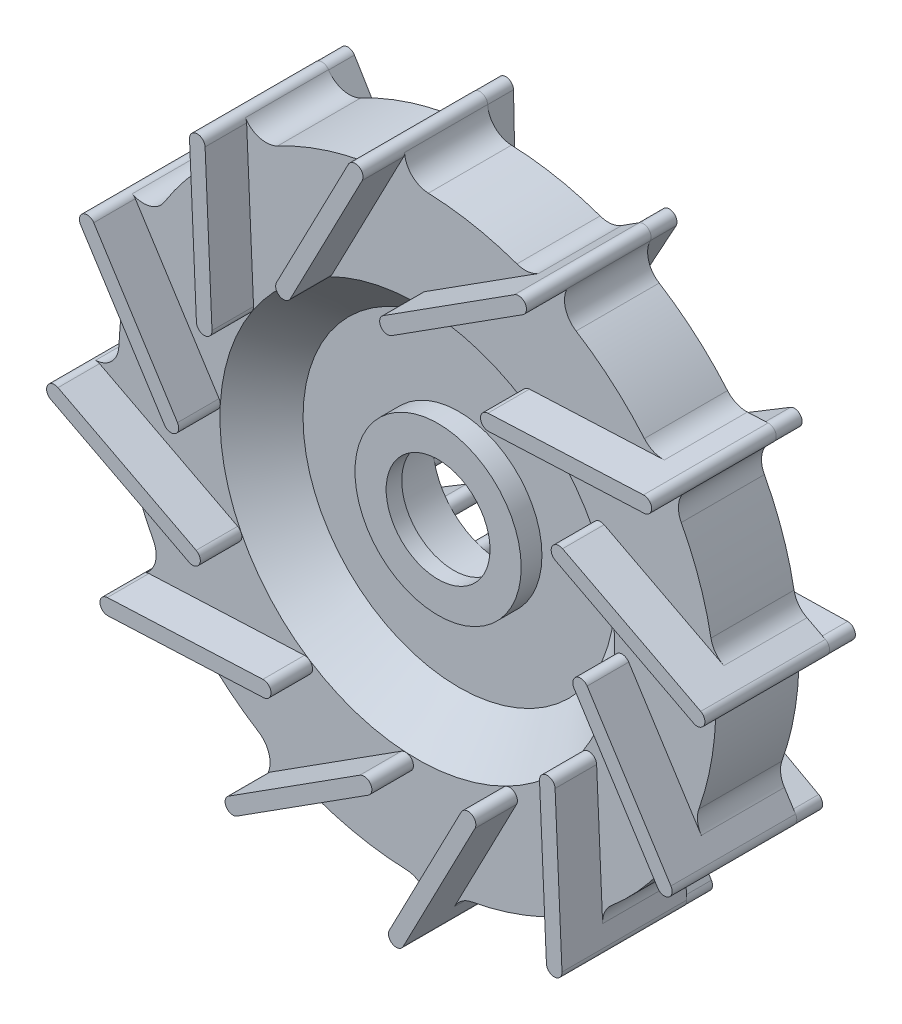
from build123d import *

# Parameters (mm, degrees)
SKETCH2_R                = 57.5
CUT_EXTRUDE1_DEPTH       = 8
SKETCH2_5_R              = 63.5
SKETCH2_5_R_2            = 57.5
CUT_EXTRUDE2_DEPTH       = 93.954289842
BOSS_EXTRUDE1_REACH      = 86.785
BOSS_EXTRUDE3_START      = -24
BOSS_EXTRUDE3_DEPTH      = 5
FILLET1_R                = 4.7625
CIRPATTERN1_COUNT        = 12
FILLET1_OF_CIRPATTERN1_R = 4.7625


with BuildPart() as part:
    # Sketch1 → Revolve1 (revolve)
    with BuildSketch(Plane.YZ, mode=Mode.PRIVATE) as revolve1_sk:
        Polygon((13, -24), (13, -15), (10, -15), (10, -12), (16, -12), (16, -16), (30, -16), (38, -8), (38, 0), (63.5, 0), (63.5, -24), align=None)
    revolve(revolve1_sk.sketch.rotate(Axis((0, 0, 0), (0, 0, -1)), 90), axis=Axis((0, 0, 0), (0, 0, -1)))

    # Sketch2 → Cut-Extrude1 (cut)
    with BuildSketch(Plane.XY):
        Circle(SKETCH2_R)
    extrude(amount=-CUT_EXTRUDE1_DEPTH, mode=Mode.SUBTRACT)

    # Sketch2<5> → Cut-Extrude2 (cut, through all)
    with BuildSketch(Plane.XY):
        Circle(SKETCH2_5_R)
        Circle(SKETCH2_5_R_2, mode=Mode.SUBTRACT)
    extrude(amount=-CUT_EXTRUDE2_DEPTH, mode=Mode.SUBTRACT)

    # Boss-Extrude1: up to this face of the body (flat: up to its plane)
    boss_extrude1_end = Plane(part.part.faces().sort_by_distance((-55.873654403, 0, -24))[0])
    # Sketch2<6> → Boss-Extrude1 (add, up to the picked face)
    with BuildSketch(Plane.XY, mode=Mode.PRIVATE) as boss_extrude1_sk1:
        with BuildLine():
            Line((26.708362532, 56.824389951), (1.442963276, 40.7003167))
            ThreePointArc((1.442963276, 40.7003167), (0.985471346, 38.628915934), (3.056872112, 38.171424003))
            Line((3.056872112, 38.171424003), (28.322271367, 54.295497255))
            ThreePointArc((28.322271367, 54.295497255), (28.779763298, 56.366898021), (26.708362532, 56.824389951))
        make_face()
    boss_extrude1_tool1 = split(extrude(boss_extrude1_sk1.sketch, amount=-BOSS_EXTRUDE1_REACH, mode=Mode.PRIVATE), bisect_by=boss_extrude1_end, keep=Keep.BOTH, mode=Mode.PRIVATE)
    boss_extrude1 = boss_extrude1_tool1.solids().sort_by(Axis((14.882617, 47.497907, 0), (0, 0, -1)))[0]
    add(boss_extrude1)

    # Sketch2<9> → Boss-Extrude3 (add)
    with BuildSketch(Plane.XY.offset(BOSS_EXTRUDE3_START)):
        with BuildLine():
            Line((24.646780442, 51.949843251), (23.4144745, 51.163400454))
            Line((23.4144745, 51.163400454), (14.5758672, 35.093362554))
            ThreePointArc((14.5758672, 35.093362554), (15.929849573, 34.499853515), (17.259721819, 33.854128297))
            Line((17.259721819, 33.854128297), (26.660264341, 50.945856606))
            ThreePointArc((26.660264341, 50.945856606), (25.658433475, 51.457699051), (24.646780442, 51.949843251))
        make_face()
        with BuildLine():
            Line((26.223407223, 56.270500903), (24.010455029, 52.246990816))
            ThreePointArc((24.010455029, 52.246990816), (24.329071398, 52.099388527), (24.646780442, 51.949843251))
            Line((24.646780442, 51.949843251), (28.322271367, 54.295497255))
            ThreePointArc((28.322271367, 54.295497255), (28.51060503, 54.437712951), (28.674302051, 54.607707533))
            Line((28.674302051, 54.607707533), (28.807226675, 54.849386303))
            ThreePointArc((28.807226675, 54.849386303), (28.225874249, 56.851853329), (26.223407223, 56.270500903))
        make_face()
        with BuildLine():
            ThreePointArc((24.646780442, 51.949843251), (24.329071398, 52.099388527), (24.010455029, 52.246990816))
            Line((24.010455029, 52.246990816), (23.4144745, 51.163400454))
            Line((23.4144745, 51.163400454), (24.646780442, 51.949843251))
        make_face()
        with BuildLine():
            Line((26.660264341, 50.945856606), (28.674302051, 54.607707533))
            ThreePointArc((28.674302051, 54.607707533), (28.51060503, 54.437712951), (28.322271367, 54.295497255))
            Line((28.322271367, 54.295497255), (24.646780442, 51.949843251))
            ThreePointArc((24.646780442, 51.949843251), (25.658433475, 51.457699051), (26.660264341, 50.945856606))
        make_face()
        with BuildLine():
            ThreePointArc((17.259721819, 33.854128297), (15.929849573, 34.499853515), (14.5758672, 35.093362554))
            Line((14.5758672, 35.093362554), (3.240582726, 14.483956015))
            ThreePointArc((3.240582726, 14.483956015), (3.160540294, 13.233334189), (4.071608842, 12.372859992))
            ThreePointArc((4.071608842, 12.372859992), (5.072556978, 12.401446557), (5.824402178, 13.062841416))
            Line((5.824402178, 13.062841416), (17.259721819, 33.854128297))
        make_face()
    boss_extrude3 = extrude(amount=-BOSS_EXTRUDE3_DEPTH)

    # Fillet1
    # the kernel refuses this fillet: 4.7625 mm, written as the material it adds along each edge
    with BuildSketch(Plane(origin=(21.335208332, 53.39530771, -24), x_dir=(-0.9358184782868557, 0.3524823055089062, 0), z_dir=(0, 0, 1))) as fillet1_piece_1:
        with BuildLine():
            CenterArc((2.384796358, -4.761555702), FILLET1_R, 91.140989858, 52.043757719)
            Line((-1.427927218, -1.907690747), (0, 0))
            ThreePointArc((0, 0), (1.14498103, -0.01140097), (2.28996206, 0))
        make_face()
    extrude(amount=16)
    with BuildSketch(Plane(origin=(24.646780442, 51.949843251, -24), x_dir=(0.8203213530171884, 0.57190285694692, 0), z_dir=(0, 0, 1))) as fillet1_piece_2:
        with BuildLine():
            CenterArc((7.385157887, -4.193915226), FILLET1_R, 118.283708435, 84.714481562)
            Line((3.001194739, -6.054633734), (2.562798425, -6.240705585))
            ThreePointArc((2.562798425, -6.240705585), (1.162915279, -3.194701016), (-0.413538593, -0.236220013))
            Line((-0.413538593, -0.236220013), (0.019424186, 0.475853721))
            ThreePointArc((0.019424186, 0.475853721), (4.375994101, 0.298020026), (4.902839936, 0.419391523))
            Line((4.902839936, 0.419391523), (5.128505204, 0))
        make_face()
    extrude(amount=16)

    # CirPattern1: Boss-Extrude1, Boss-Extrude3 ×12 about axis
    cirpattern1_axis = Axis((0, 0, 0), (0, 0, 1))
    add([boss_extrude1.rotate(cirpattern1_axis, i * 360 / CIRPATTERN1_COUNT) for i in range(1, CIRPATTERN1_COUNT)])
    add([boss_extrude3.rotate(cirpattern1_axis, i * 360 / CIRPATTERN1_COUNT) for i in range(1, CIRPATTERN1_COUNT)])

    # Fillet1 of CirPattern1
    # the kernel refuses this fillet: 4.7625 mm, written as the material it adds along each edge
    with BuildSketch(Plane(origin=(-8.220821445, 56.909297086, -24), x_dir=(0.46104363369158735, 0.8873774663763202, 0), z_dir=(0, 0, 1)), Plane(origin=(-35.574088754, 45.174486265, -24), x_dir=(-0.04441323415815749, 0.9990132454735587, 0), z_dir=(0, 0, 1)), Plane(origin=(-53.39530771, 21.335208332, -24), x_dir=(-0.5379696117819751, 0.8429642322181593, 0), z_dir=(0, 0, 1)), Plane(origin=(-56.909297086, -8.220821445, -24), x_dir=(-0.8873774663763218, 0.4610436336915846, 0), z_dir=(0, 0, 1)), Plane(origin=(-45.174486265, -35.574088754, -24), x_dir=(-0.9990132454735587, -0.04441323415815762, 0), z_dir=(0, 0, 1)), Plane(origin=(-21.335208332, -53.39530771, -24), x_dir=(-0.8429642322181615, -0.5379696117819718, 0), z_dir=(0, 0, 1)), Plane(origin=(8.220821445, -56.909297086, -24), x_dir=(-0.461043633691588, -0.88737746637632, 0), z_dir=(0, 0, 1)), Plane(origin=(35.574088754, -45.174486265, -24), x_dir=(0.04441323415816072, -0.9990132454735585, 0), z_dir=(0, 0, 1)), Plane(origin=(53.39530771, -21.335208332, -24), x_dir=(0.5379696117819723, -0.8429642322181613, 0), z_dir=(0, 0, 1)), Plane(origin=(56.909297086, 8.220821445, -24), x_dir=(0.8873774663763205, -0.4610436336915868, 0), z_dir=(0, 0, 1))) as fillet1_of_cirpattern1_piece_1:
        with BuildLine():
            CenterArc((2.382910012, 4.7625), FILLET1_OF_CIRPATTERN1_R, 217.956242281, 52.043757719)
            ThreePointArc((-1.37222939, 1.83327923), (-0.676987399, 0.923471495), (0, 0))
            Line((0, 0), (2.382910012, 0))
        make_face()
    extrude(amount=16)
    with BuildSketch(Plane(origin=(-4.630183642, 57.313274199, -24), x_dir=(0.9997620358082159, 0.021814485018253862, 0), z_dir=(0, 0, 1)), Plane(origin=(-32.666493757, 47.31965961, -24), x_dir=(0.8549120782400353, 0.5187729161003914, 0), z_dir=(0, 0, 1)), Plane(origin=(-51.949843251, 24.646780442, -24), x_dir=(0.48098911970782304, 0.8767265632582906, 0), z_dir=(0, 0, 1)), Plane(origin=(-57.313274199, -4.630183642, -24), x_dir=(-0.02181448501825498, 0.9997620358082159, 0), z_dir=(0, 0, 1)), Plane(origin=(-47.31965961, -32.666493757, -24), x_dir=(-0.5187729161003926, 0.8549120782400345, 0), z_dir=(0, 0, 1)), Plane(origin=(-24.646780442, -51.949843251, -24), x_dir=(-0.876726563258291, 0.48098911970782227, 0), z_dir=(0, 0, 1)), Plane(origin=(4.630183642, -57.313274199, -24), x_dir=(-0.9997620358082159, -0.021814485018255857, 0), z_dir=(0, 0, 1)), Plane(origin=(32.666493757, -47.31965961, -24), x_dir=(-0.854912078240035, -0.5187729161003919, 0), z_dir=(0, 0, 1)), Plane(origin=(51.949843251, -24.646780442, -24), x_dir=(-0.4809891197078244, -0.87672656325829, 0), z_dir=(0, 0, 1)), Plane(origin=(57.313274199, 4.630183642, -24), x_dir=(0.021814485018254864, -0.9997620358082159, 0), z_dir=(0, 0, 1)), Plane(origin=(47.31965961, 32.666493757, -24), x_dir=(0.5187729161003922, -0.8549120782400348, 0), z_dir=(0, 0, 1))) as fillet1_of_cirpattern1_piece_2:
        with BuildLine():
            CenterArc((7.037499151, 4.754270463), FILLET1_OF_CIRPATTERN1_R, 181.91675599, 84.714481562)
            Line((2.277663879, 4.594976919), (1.801680352, 4.579047565))
            ThreePointArc((1.801680352, 4.579047565), (1.676443372, 4.053107194), (-0.417723101, 0.228738877))
            Line((-0.417723101, 0.228738877), (0.027985463, -0.475427046))
            ThreePointArc((0.027985463, -0.475427046), (3.378822262, -0.376890764), (6.729659062, -0.475427046))
            Line((6.729659062, -0.475427046), (6.757644525, 0))
        make_face()
    extrude(amount=16)
    with BuildSketch(Plane(origin=(45.174486265, 35.574088754, -24), x_dir=(-0.6342014227728653, 0.7731678700986439, 0), z_dir=(0, 0, 1))) as fillet1_of_cirpattern1_piece_3:
        with BuildLine():
            CenterArc((2.384796358, -4.761555702), FILLET1_OF_CIRPATTERN1_R, 91.140989858, 52.043757719)
            Line((-1.427927218, -1.907690747), (0, 0))
            ThreePointArc((0, 0), (1.14498103, -0.01140097), (2.28996206, 0))
        make_face()
    extrude(amount=16)


solid = part.part
